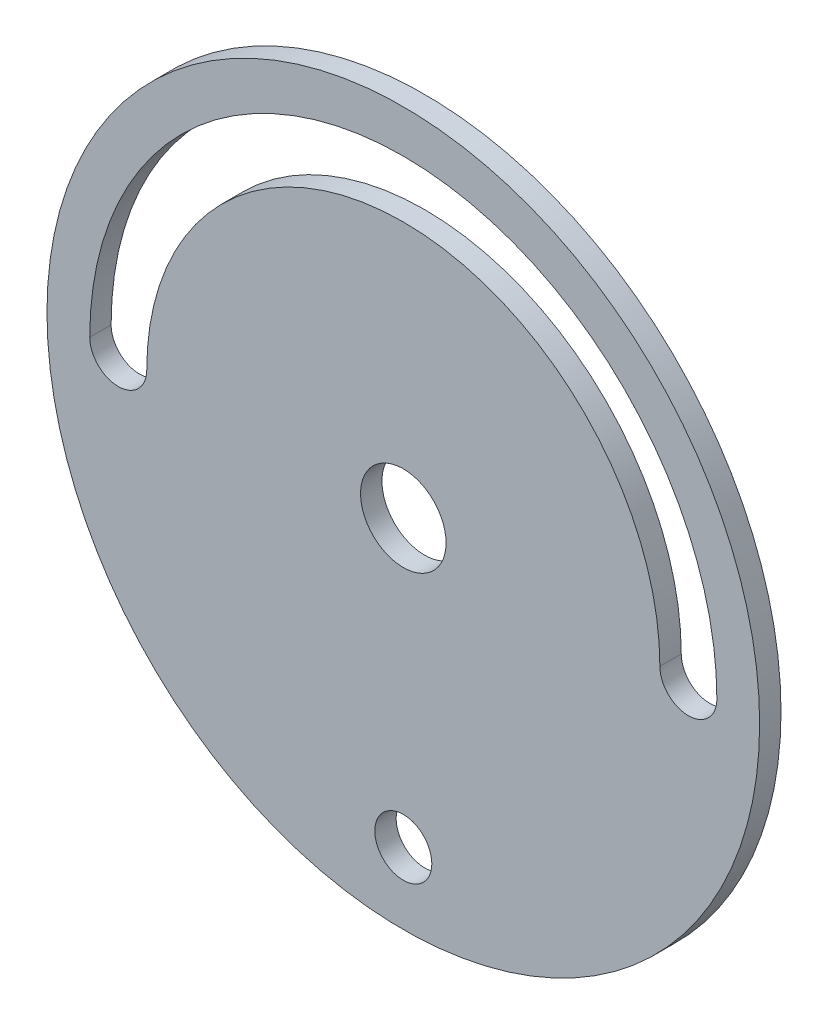
from build123d import *

# Parameters (mm, degrees)
SKETCH1_R           = 25
SKETCH1_R_2         = 2
SKETCH1_R_3         = 3
BOSS_EXTRUDE1_DEPTH = 1.5


with BuildPart() as part:
    # Sketch1 → Boss-Extrude1 (new body)
    with BuildSketch(Plane.XY):
        with Locations((-2.056478496, 7.394811009)):
            Circle(SKETCH1_R)
        with Locations((-2.056478496, -12.605188991)):
            Circle(SKETCH1_R_2, mode=Mode.SUBTRACT)
        with Locations((-2.056478496, 7.394811009)):
            Circle(SKETCH1_R_3, mode=Mode.SUBTRACT)
        with BuildLine():
            ThreePointArc((19.943521504, 7.394811009), (-2.056478496, 29.394811009), (-24.056478496, 7.394811009))
            ThreePointArc((-24.056478496, 7.394811009), (-22.056478496, 5.394811009), (-20.056478496, 7.394811009))
            ThreePointArc((-20.056478496, 7.394811009), (-2.056478496, 25.394811009), (15.943521504, 7.394811009))
            ThreePointArc((15.943521504, 7.394811009), (17.943521504, 5.394811009), (19.943521504, 7.394811009))
        make_face(mode=Mode.SUBTRACT)
    extrude(amount=BOSS_EXTRUDE1_DEPTH)


solid = part.part
